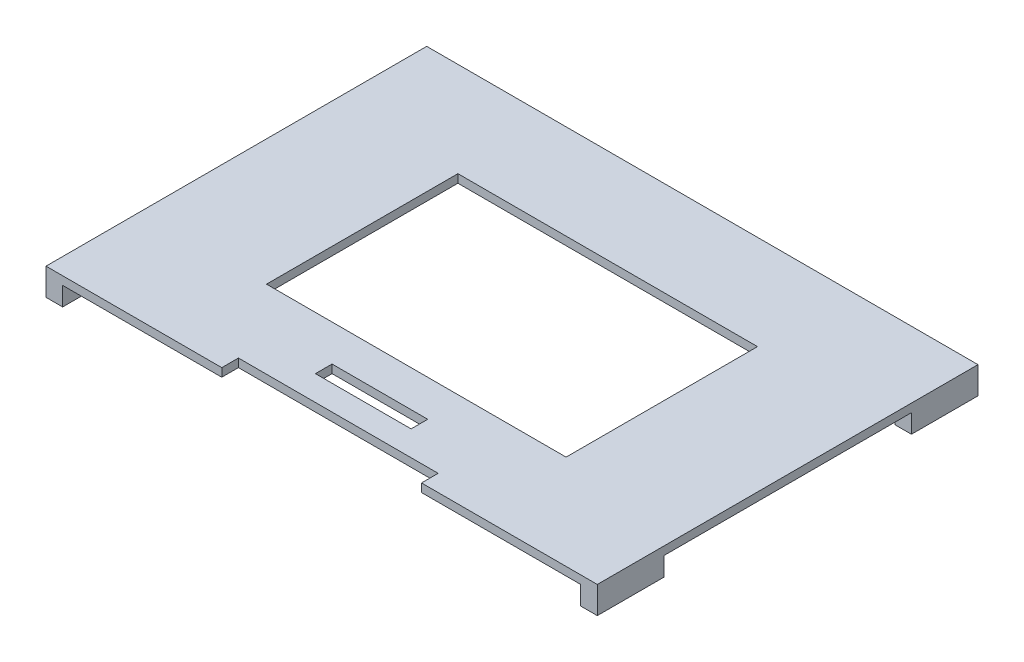
from build123d import *

# Parameters (mm, degrees)
SKETCH1_W           = 420.6875
SKETCH1_H           = 290.5125
BOSS_EXTRUDE1_DEPTH = 6.35
SKETCH2_W           = 228.6
SKETCH2_H           = 146.05
SKETCH2_W_2         = 73.025
SKETCH2_H_2         = 12.7
SKETCH2_W_3         = 152.4
CUT_EXTRUDE1_DEPTH  = 256.703331672
SKETCH4_W           = 12.7
SKETCH4_H           = 50.8
BOSS_EXTRUDE2_DEPTH = 14.2875


with BuildPart() as part:
    # Sketch1 → Boss-Extrude1 (new body)
    with BuildSketch(Plane(origin=(0, 0, 0), x_dir=(1, 0, 0), z_dir=(0, 1, 0))):
        Rectangle(SKETCH1_W, SKETCH1_H)
    extrude(amount=BOSS_EXTRUDE1_DEPTH)

    # Sketch2 → Cut-Extrude1 (cut, through all)
    with BuildSketch(Plane(origin=(0, 6.35, 0), x_dir=(1, 0, 0), z_dir=(0, 1, 0))):
        Rectangle(SKETCH2_W, SKETCH2_H)
        with Locations((0, -107.15625)):
            Rectangle(SKETCH2_W_2, SKETCH2_H_2)
        with Locations((0, -138.90625)):
            Rectangle(SKETCH2_W_3, SKETCH2_H_2)
    extrude(amount=-CUT_EXTRUDE1_DEPTH, mode=Mode.SUBTRACT)

    # Sketch4 → Boss-Extrude2 (add)
    with BuildSketch(Plane.XZ):
        with Locations((-203.99375, 119.85625)):
            Rectangle(SKETCH4_W, SKETCH4_H)
        with Locations((203.99375, 119.85625)):
            Rectangle(SKETCH4_W, SKETCH4_H)
        with Locations((-203.99375, -119.85625)):
            Rectangle(SKETCH4_W, SKETCH4_H)
        with Locations((203.99375, -119.85625)):
            Rectangle(SKETCH4_W, SKETCH4_H)
    extrude(amount=BOSS_EXTRUDE2_DEPTH)


solid = part.part
